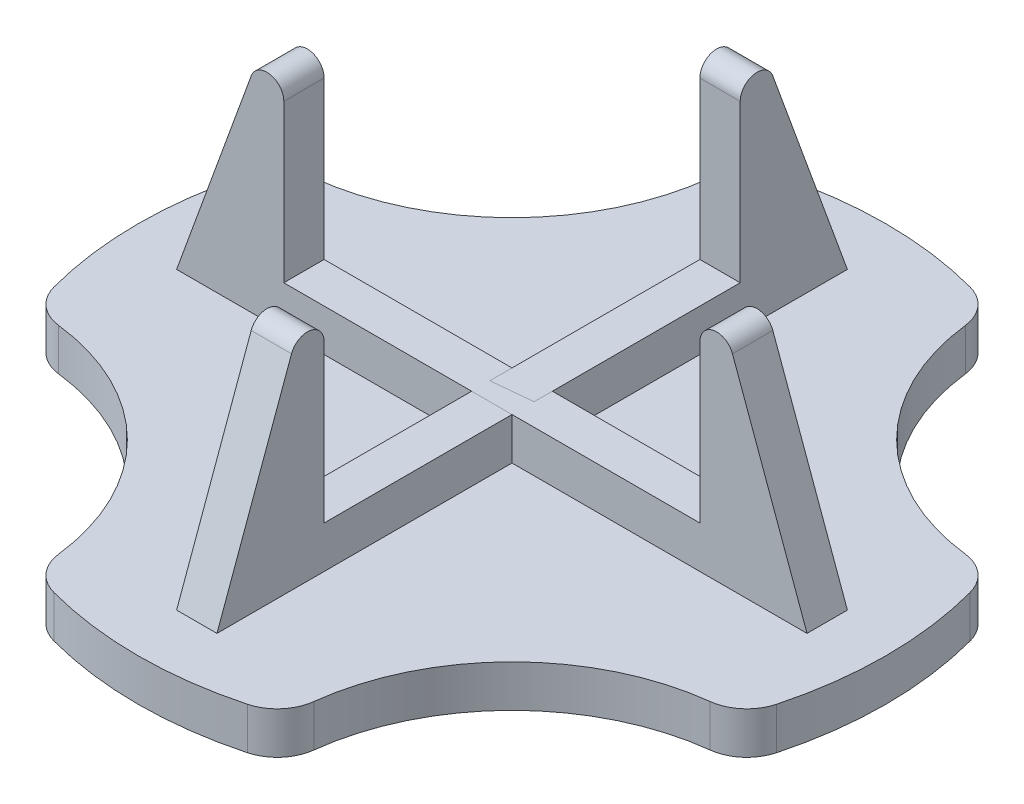
from build123d import *

# Parameters (mm, degrees)
SKETCH1_R           = 56.515
SKETCH1_W           = 63.983450824
SKETCH1_H           = 6.096
BOSS_EXTRUDE1_DEPTH = 6.35
BOSS_EXTRUDE2_DEPTH = 3.048
CIRPATTERN1_COUNT   = 2
CIRPATTERN1_ANGLE   = 90
SKETCH3_R           = 34.157543873
CUT_EXTRUDE1_DEPTH  = 89.920312598
FILLET1_START       = -1
FILLET1_DEPTH       = 8
CIRPATTERN2_COUNT   = 4


with BuildPart() as part:
    # Sketch1 → Boss-Extrude1 (new body)
    with BuildSketch(Plane(origin=(0, 0, 0), x_dir=(1, 0, 0), z_dir=(0, 1, 0))):
        with Locations(Location((0, 0, 0), (0, 0, 270))):
            Circle(SKETCH1_R)
        Rectangle(SKETCH1_W, SKETCH1_H, mode=Mode.SUBTRACT)
    extrude(amount=BOSS_EXTRUDE1_DEPTH)

    # Sketch3 → Cut-Extrude1 (cut, through all)
    with BuildSketch(Plane(origin=(0, 0, 0), x_dir=(1, 0, 0), z_dir=(0, 1, 0))):
        with Locations((-53.207543873, 53.207543873)):
            Circle(SKETCH3_R)
    cut_extrude1 = extrude(amount=CUT_EXTRUDE1_DEPTH, mode=Mode.SUBTRACT)

    # Fillet1: read off the stored shape, not the designer's step
    # Fillet1 outline → Fillet1 (cut)
    with BuildSketch(Plane(origin=(0, 0, 0), x_dir=(1, 0, 0), z_dir=(0, 1, 0)).offset(FILLET1_START)):
        with BuildLine():
            ThreePointArc((-53.207543873, 19.05), (-53.944482234, 16.850461759), (-54.590536828, 14.622534453))
            ThreePointArc((-54.590536828, 14.622534453), (-52.611862262, 17.781396141), (-49.201504559, 19.285730059))
            ThreePointArc((-49.201504559, 19.285730059), (-51.201059407, 19.108983441), (-53.207543873, 19.05))
        make_face()
        with BuildLine():
            ThreePointArc((-19.285730059, 49.201504559), (-17.781396141, 52.611862262), (-14.622534453, 54.590536828))
            ThreePointArc((-14.622534453, 54.590536828), (-16.850461759, 53.944482234), (-19.05, 53.207543873))
            ThreePointArc((-19.05, 53.207543873), (-19.108983441, 51.201059407), (-19.285730059, 49.201504559))
        make_face()
    fillet1 = extrude(amount=FILLET1_DEPTH, mode=Mode.SUBTRACT)

    # CirPattern2: Cut-Extrude1, Fillet1 ×4 about axis
    cirpattern2_axis = Axis((0, 0, 0), (0, 1, 0))
    add([cut_extrude1.rotate(cirpattern2_axis, i * 360 / CIRPATTERN2_COUNT) for i in range(1, CIRPATTERN2_COUNT)], mode=Mode.SUBTRACT)
    add([fillet1.rotate(cirpattern2_axis, i * 360 / CIRPATTERN2_COUNT) for i in range(1, CIRPATTERN2_COUNT)], mode=Mode.SUBTRACT)


with BuildPart() as body_2:
    # Sketch2 → Boss-Extrude2 (new, symmetric)
    with BuildSketch(Plane.XY):
        with BuildLine():
            Line((-47.625, 6.35), (-36.359319257, 37.302203457))
            ThreePointArc((-36.359319257, 37.302203457), (-33.531433629, 38.934883985), (-31.4325, 36.433472293))
            Line((-31.4325, 36.433472293), (-31.4325, 12.7))
            Line((-31.4325, 12.7), (31.4325, 12.7))
            Line((31.4325, 12.7), (31.4325, 36.433472293))
            ThreePointArc((31.4325, 36.433472293), (33.531433629, 38.934883985), (36.359319257, 37.302203457))
            Line((36.359319257, 37.302203457), (47.625, 6.35))
            Line((47.625, 6.35), (47.625, 0))
            Line((47.625, 0), (-47.625, 0))
            Line((-47.625, 0), (-47.625, 6.35))
        make_face()
    extrude(amount=BOSS_EXTRUDE2_DEPTH, both=True)


with BuildPart() as cirpattern1_1:
    # CirPattern1: pattern copy
    add(body_2.part.rotate(Axis((0, 0, 0), (0, -1, 0)), 1 * CIRPATTERN1_ANGLE / (CIRPATTERN1_COUNT - 1)))


solid = Compound([part.part, body_2.part, cirpattern1_1.part])
